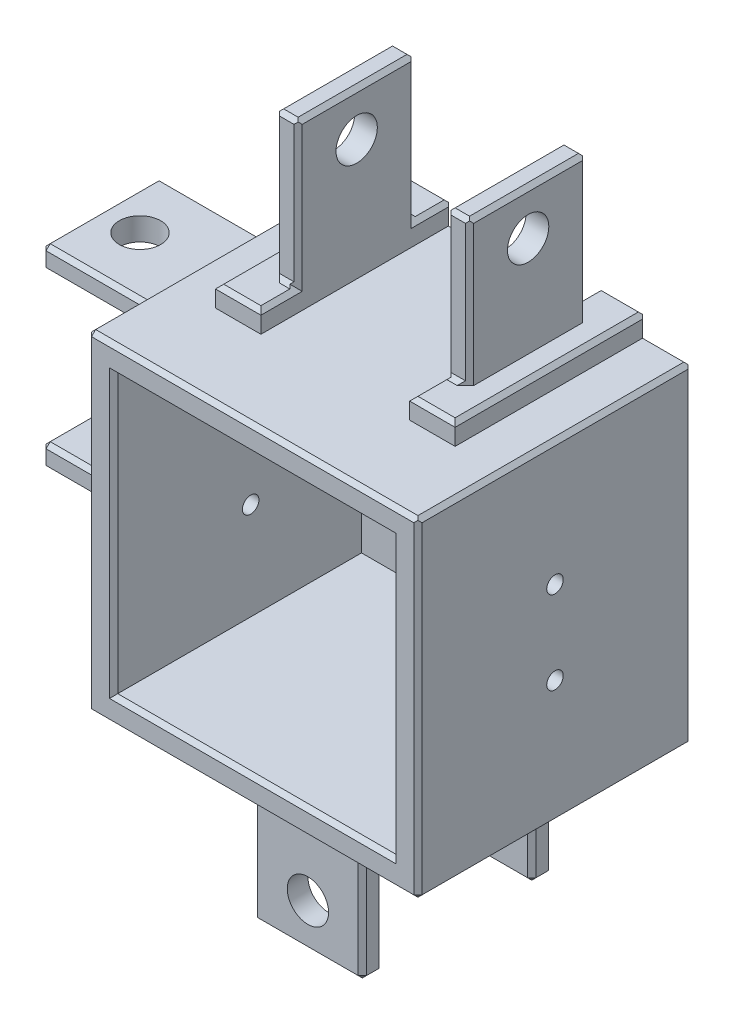
from build123d import *

# Parameters (mm, degrees)
CROQUIS2_W                = 80
CROQUIS2_H                = 80
SALIENTE_EXTRUIR1_DEPTH   = 6.35
CROQUIS4_W                = 80
CROQUIS4_H                = 80
CROQUIS4_W_2              = 67.3
CROQUIS4_H_2              = 67.3
SALIENTE_EXTRUIR2_DEPTH   = 60
CROQUIS5_R                = 30
CORTAR_EXTRUIR1_DEPTH     = 40
SALIENTE_EXTRUIR3_DEPTH   = 5
SALIENTE_EXTRUIR3_2_DEPTH = 5
CROQUIS8_W                = 5.5
CROQUIS8_H                = 28.35
SALIENTE_EXTRUIR4_DEPTH   = 40
CORTAR_EXTRUIR2_REACH     = 112.281
CROQUIS9_R                = 5
SALIENTE_EXTRUIR5_DEPTH   = 5
CROQUIS11_W               = 28.35
CROQUIS11_H               = 5.5
SALIENTE_EXTRUIR6_DEPTH   = 40
CORTAR_EXTRUIR3_REACH     = 117.521
CROQUIS12_R               = 5
CROQUIS13_W               = 46.35
CROQUIS13_H               = 7
SALIENTE_EXTRUIR7_DEPTH   = 5
CROQUIS14_W               = 26.35
CROQUIS14_H               = 5
SALIENTE_EXTRUIR8_DEPTH   = 40
CROQUIS15_R               = 5
CORTAR_EXTRUIR4_DEPTH     = 70
CORTAR_EXTRUIR5_REACH     = 171.094
CROQUIS16_R               = 2
CHAFL_N1_SIZE             = 1
CHAFL_N2_SIZE             = 1
CHAFL_N9_SIZE             = 1
CHAFL_N10_SIZE            = 1
CHAFL_N11_SIZE            = 1
CHAFL_N12_SIZE            = 1
CHAFL_N13_SIZE            = 1
CHAFL_N14_SIZE            = 1
CHAFL_N15_SIZE            = 1


with BuildPart() as part:
    # Croquis2 → Saliente-Extruir1 (new body)
    with BuildSketch(Plane.XY):
        with Locations((9.92481203, -18.947368421)):
            Rectangle(CROQUIS2_W, CROQUIS2_H)
    extrude(amount=SALIENTE_EXTRUIR1_DEPTH)

    # Croquis4 → Saliente-Extruir2 (add)
    with BuildSketch(Plane.XY.offset(6.35)):
        with Locations((9.92481203, -18.947368421)):
            Rectangle(CROQUIS4_W, CROQUIS4_H)
        with Locations((9.92481203, -18.947368421)):
            Rectangle(CROQUIS4_W_2, CROQUIS4_H_2, mode=Mode.SUBTRACT)
    extrude(amount=SALIENTE_EXTRUIR2_DEPTH)

    # Croquis5 → Cortar-Extruir1 (cut)
    with BuildSketch(Plane.XY.offset(6.35)):
        with Locations((9.92481203, -18.947368421)):
            Circle(CROQUIS5_R)
    extrude(amount=-CORTAR_EXTRUIR1_DEPTH, mode=Mode.SUBTRACT)



with BuildPart() as body_2:
    # Croquis6 → Saliente-Extruir3 (new body)
    with BuildSketch(Plane(origin=(0, 21.052631579, 0), x_dir=(1, 0, 0), z_dir=(0, 1, 0))):
        Polygon((38.92481203, 0), (27.92481203, 0), (27.92481203, -9), (33.42481203, -9), (33.42481203, -37.35), (27.92481203, -37.35), (27.92481203, -46.35), (38.92481203, -46.35), align=None)
    extrude(amount=SALIENTE_EXTRUIR3_DEPTH)


with BuildPart() as body_3:
    # Croquis6 → Saliente-Extruir3 2 (new body)
    with BuildSketch(Plane(origin=(0, 21.052631579, 0), x_dir=(1, 0, 0), z_dir=(0, 1, 0))):
        Polygon((-13.57518797, -37.35), (-13.57518797, -9), (-8.07518797, -9), (-8.07518797, 0), (-19.07518797, 0), (-19.07518797, -46.35), (-8.07518797, -46.35), (-8.07518797, -37.35), align=None)
    extrude(amount=SALIENTE_EXTRUIR3_2_DEPTH)


with BuildPart() as part_1:
    add(part.part)

    add(body_2.part)  # Saliente-Extruir4 merges body 2

    add(body_3.part)  # Saliente-Extruir4 merges body 3
    # Croquis8 → Saliente-Extruir4 (add)
    with BuildSketch(Plane(origin=(0, 21.052631579, 0), x_dir=(1, 0, 0), z_dir=(0, 1, 0))):
        with Locations((-10.82518797, -23.175)):
            Rectangle(CROQUIS8_W, CROQUIS8_H)
        with Locations((30.67481203, -23.175)):
            Rectangle(CROQUIS8_W, CROQUIS8_H)
    extrude(amount=SALIENTE_EXTRUIR4_DEPTH)

    # Cortar-Extruir2: up to this face of the body (flat: up to its plane)
    cortar_extruir2_end = Plane(part_1.part.faces().sort_by_distance((33.42481203, 43.552631579, 23.175))[0])
    # Croquis9 → Cortar-Extruir2 (cut, up to the picked face)
    with BuildSketch(Plane.ZY.offset(13.57518797), mode=Mode.PRIVATE) as cortar_extruir2_sk1:
        with Locations((23.175, 50.31614922)):
            Circle(CROQUIS9_R)
    cortar_extruir2_tool1 = split(extrude(cortar_extruir2_sk1.sketch, amount=-CORTAR_EXTRUIR2_REACH, mode=Mode.PRIVATE), bisect_by=cortar_extruir2_end, keep=Keep.BOTH, mode=Mode.PRIVATE)
    add(cortar_extruir2_tool1.solids().sort_by(Axis((-13.575188, 50.316149, 23.175), (1, 0, 0)))[0], mode=Mode.SUBTRACT)

    # Croquis10 → Saliente-Extruir5 (add)
    with BuildSketch(Plane.ZY.offset(30.07518797)):
        Polygon((37.35, 4.552631579), (37.35, -0.947368421), (46.35, -0.947368421), (46.35, 10.052631579), (0, 10.052631579), (0, -0.947368421), (9, -0.947368421), (9, 4.552631579), align=None)
        Polygon((9, -36.947368421), (0, -36.947368421), (0, -47.947368421), (46.35, -47.947368421), (46.35, -36.947368421), (37.35, -36.947368421), (37.35, -42.447368421), (9, -42.447368421), align=None)
    extrude(amount=SALIENTE_EXTRUIR5_DEPTH)

    # Croquis11 → Saliente-Extruir6 (add)
    with BuildSketch(Plane.ZY.offset(30.07518797)):
        with Locations((23.175, 1.802631579)):
            Rectangle(CROQUIS11_W, CROQUIS11_H)
        with Locations((23.175, -39.697368421)):
            Rectangle(CROQUIS11_W, CROQUIS11_H)
    extrude(amount=SALIENTE_EXTRUIR6_DEPTH)

    # Cortar-Extruir3: up to this face of the body (flat: up to its plane)
    cortar_extruir3_end = Plane(part_1.part.faces().sort_by_distance((-52.57518797, -42.447368421, 23.175))[0])
    # Croquis12 → Cortar-Extruir3 (cut, up to the picked face)
    with BuildSketch(Plane(origin=(0, 4.552631579, 0), x_dir=(1, 0, 0), z_dir=(0, 1, 0)), mode=Mode.PRIVATE) as cortar_extruir3_sk1:
        with Locations(Location((-60.518987286, -23.175, 0), (0, 0, 270))):
            Circle(CROQUIS12_R)
    cortar_extruir3_tool1 = split(extrude(cortar_extruir3_sk1.sketch, amount=-CORTAR_EXTRUIR3_REACH, mode=Mode.PRIVATE), bisect_by=cortar_extruir3_end, keep=Keep.BOTH, mode=Mode.PRIVATE)
    add(cortar_extruir3_tool1.solids().sort_by(Axis((-60.518987, 4.552632, 23.175), (0, -1, 0)))[0], mode=Mode.SUBTRACT)

    # Croquis13 → Saliente-Extruir7 (add)
    with BuildSketch(Plane.XZ.offset(58.947368421)):
        with Locations((6.949244079, 5.5)):
            Rectangle(CROQUIS13_W, CROQUIS13_H)
        with Locations((6.949244079, 48.5)):
            Rectangle(CROQUIS13_W, CROQUIS13_H)
    extrude(amount=SALIENTE_EXTRUIR7_DEPTH)

    # Croquis14 → Saliente-Extruir8 (add)
    with BuildSketch(Plane.XZ.offset(58.947368421)):
        with Locations((6.949244079, 47.5)):
            Rectangle(CROQUIS14_W, CROQUIS14_H)
        with Locations((6.949244079, 6.5)):
            Rectangle(CROQUIS14_W, CROQUIS14_H)
    extrude(amount=SALIENTE_EXTRUIR8_DEPTH)

    # Croquis15 → Cortar-Extruir4 (cut)
    with BuildSketch(Plane(origin=(0, 0, 4), x_dir=(-1, 0, 0), z_dir=(0, 0, -1))):
        with Locations((-6.949244079, -88.311094309)):
            Circle(CROQUIS15_R)
    extrude(amount=-CORTAR_EXTRUIR4_DEPTH, mode=Mode.SUBTRACT)

    # Cortar-Extruir5: up to this face of the body (flat: up to its plane)
    cortar_extruir5_end = Plane(part_1.part.faces().sort_by_distance((-30.07518797, -18.947368421, 35.552865355))[0])
    # Croquis16 → Cortar-Extruir5 (cut, up to the picked face)
    with BuildSketch(Plane(origin=(49.92481203, 0, 0), x_dir=(0, 0, -1), z_dir=(1, 0, 0)), mode=Mode.PRIVATE) as cortar_extruir5_sk1:
        with Locations((-33.175, -29.066401089)):
            Circle(CROQUIS16_R)
    cortar_extruir5_tool1 = split(extrude(cortar_extruir5_sk1.sketch, amount=-CORTAR_EXTRUIR5_REACH, mode=Mode.PRIVATE), bisect_by=cortar_extruir5_end, keep=Keep.BOTH, mode=Mode.PRIVATE)
    # Croquis16 → Cortar-Extruir5 (cut, up to the picked face)
    with BuildSketch(Plane(origin=(49.92481203, 0, 0), x_dir=(0, 0, -1), z_dir=(1, 0, 0)), mode=Mode.PRIVATE) as cortar_extruir5_sk2:
        with Locations((-33.175, -8.947368421)):
            Circle(CROQUIS16_R)
    cortar_extruir5_tool2 = split(extrude(cortar_extruir5_sk2.sketch, amount=-CORTAR_EXTRUIR5_REACH, mode=Mode.PRIVATE), bisect_by=cortar_extruir5_end, keep=Keep.BOTH, mode=Mode.PRIVATE)
    add(cortar_extruir5_tool1.solids().sort_by(Axis((49.924812, -29.066401, 33.175), (-1, 0, 0)))[0], mode=Mode.SUBTRACT)
    add(cortar_extruir5_tool2.solids().sort_by(Axis((49.924812, -8.947368, 33.175), (-1, 0, 0)))[0], mode=Mode.SUBTRACT)

    # Chaflán1
    chafl_n1_edges = [part_1.edges().sort_by_distance(p)[0] for p in [
        (-30.07518797, -18.947368421, 0),
        (-32.57518797, 10.052631579, 0),
        (-32.57518797, -0.947368421, 0),
        (-35.07518797, 4.552631579, 0),
        (-30.07518797, -53.447368421, 0),
        (-32.57518797, -36.947368421, 0),
        (-32.57518797, -47.947368421, 0),
        (-35.07518797, -42.447368421, 0),
        (-30.07518797, -18.947368421, 66.35),
        (9.92481203, -58.947368421, 66.35),
        (49.92481203, -18.947368421, 66.35),
        (9.92481203, 21.052631579, 66.35),
        (49.92481203, -18.947368421, 0),
        (9.92481203, -58.947368421, 0),
        (-30.07518797, 15.552631579, 0),
        (-24.57518797, 21.052631579, 0),
        (44.42481203, 21.052631579, 0),
        (-8.07518797, 23.552631579, 0),
        (-19.07518797, 23.552631579, 0),
        (-13.57518797, 26.052631579, 0),
        (49.92481203, -58.947368421, 33.175),
        (9.92481203, 21.052631579, 0),
        (-30.07518797, -58.947368421, 33.175),
        (-30.07518797, 21.052631579, 33.175),
        (38.92481203, 23.552631579, 0),
        (27.92481203, 23.552631579, 0),
        (33.42481203, 26.052631579, 0),
    ]]
    chamfer(chafl_n1_edges, length=CHAFL_N1_SIZE)

    # Chaflán2
    chafl_n2_edges = [part_1.edges().sort_by_distance(p)[0] for p in [
        (-23.72518797, -18.947368421, 66.35),
        (9.92481203, -52.597368421, 66.35),
        (43.57481203, -18.947368421, 66.35),
        (9.92481203, 14.702631579, 66.35),
        (49.92481203, 21.052631579, 33.175),
    ]]
    chamfer(chafl_n2_edges, length=CHAFL_N2_SIZE)

    # Chaflán9
    chafl_n9_edges = [part_1.edges().sort_by_distance(p)[0] for p in [
        (-8.07518797, 61.052631579, 23.175),
        (-10.82518797, 61.052631579, 9),
        (-13.57518797, 61.052631579, 23.175),
        (-10.82518797, 61.052631579, 37.35),
    ]]
    chamfer(chafl_n9_edges, length=CHAFL_N9_SIZE)

    # Chaflán10
    chafl_n10_edges = [part_1.edges().sort_by_distance(p)[0] for p in [
        (30.67481203, 61.052631579, 9),
        (27.92481203, 61.052631579, 23.175),
        (30.67481203, 61.052631579, 37.35),
        (33.42481203, 61.052631579, 23.175),
    ]]
    chamfer(chafl_n10_edges, length=CHAFL_N10_SIZE)

    # Chaflán11
    chafl_n11_edges = [part_1.edges().sort_by_distance(p)[0] for p in [
        (38.92481203, 26.052631579, 23.675),
        (27.92481203, 26.052631579, 5),
        (-8.07518797, 26.052631579, 5),
        (-19.07518797, 26.052631579, 23.675),
        (-13.57518797, 43.052631579, 37.35),
        (-13.57518797, 43.052631579, 9),
        (-8.07518797, 43.052631579, 9),
        (-8.07518797, 43.052631579, 37.35),
        (33.42481203, 43.052631579, 9),
        (33.42481203, 43.052631579, 37.35),
        (27.92481203, 43.052631579, 37.35),
        (27.92481203, 43.052631579, 9),
        (-13.57518797, 26.052631579, 46.35),
        (-8.07518797, 26.052631579, 41.85),
        (27.92481203, 26.052631579, 41.85),
        (33.42481203, 26.052631579, 46.35),
    ]]
    chamfer(chafl_n11_edges, length=CHAFL_N11_SIZE)

    # Chaflán12
    chafl_n12_edges = [part_1.edges().sort_by_distance(p)[0] for p in [
        (-35.07518797, -0.947368421, 41.85),
        (-35.07518797, 4.552631579, 46.35),
        (-35.07518797, -36.947368421, 41.85),
        (-35.07518797, -42.447368421, 46.35),
        (-52.57518797, 4.552631579, 37.35),
        (-52.57518797, 4.552631579, 9),
        (-52.57518797, -0.947368421, 9),
        (-52.57518797, -0.947368421, 37.35),
        (-70.07518797, 4.552631579, 23.175),
        (-70.07518797, 1.802631579, 9),
        (-70.07518797, -0.947368421, 23.175),
        (-70.07518797, 1.802631579, 37.35),
        (-52.57518797, -36.947368421, 37.35),
        (-52.57518797, -36.947368421, 9),
        (-52.57518797, -42.447368421, 9),
        (-52.57518797, -42.447368421, 37.35),
        (-70.07518797, -36.947368421, 23.175),
        (-70.07518797, -39.697368421, 9),
        (-70.07518797, -42.447368421, 23.175),
        (-70.07518797, -39.697368421, 37.35),
        (-35.07518797, 10.052631579, 23.675),
        (-35.07518797, -0.947368421, 5),
        (-35.07518797, -36.947368421, 5),
        (-35.07518797, -47.947368421, 23.675),
    ]]
    chamfer(chafl_n12_edges, length=CHAFL_N12_SIZE)

    # Chaflán13
    chafl_n13_edges = [part_1.edges().sort_by_distance(p)[0] for p in [
        (6.949244079, -63.947368421, 52),
        (-16.225755921, -63.947368421, 48.5),
        (-11.225755921, -63.947368421, 45),
        (30.124244079, -63.947368421, 48.5),
        (-11.225755921, -63.947368421, 9),
        (6.949244079, -63.947368421, 2),
        (30.124244079, -63.947368421, 5.5),
        (-16.225755921, -63.947368421, 5.5),
        (25.124244079, -63.947368421, 9),
        (20.124244079, -63.947368421, 6.5),
        (6.949244079, -63.947368421, 4),
        (-6.225755921, -63.947368421, 6.5),
        (-6.225755921, -81.447368421, 9),
        (-6.225755921, -81.447368421, 4),
        (20.124244079, -81.447368421, 4),
        (20.124244079, -81.447368421, 9),
        (-6.225755921, -98.947368421, 6.5),
        (6.949244079, -98.947368421, 4),
        (20.124244079, -98.947368421, 6.5),
        (6.949244079, -98.947368421, 9),
        (25.124244079, -63.947368421, 45),
        (6.949244079, -63.947368421, 50),
        (20.124244079, -63.947368421, 47.5),
        (-6.225755921, -63.947368421, 47.5),
        (-6.225755921, -81.447368421, 50),
        (-6.225755921, -81.447368421, 45),
        (20.124244079, -81.447368421, 45),
        (20.124244079, -81.447368421, 50),
        (-6.225755921, -98.947368421, 47.5),
        (6.949244079, -98.947368421, 45),
        (20.124244079, -98.947368421, 47.5),
        (6.949244079, -98.947368421, 50),
    ]]
    chamfer(chafl_n13_edges, length=CHAFL_N13_SIZE - 0.0001)  # a hair under: the kernel refuses the full size

    # Chaflán14
    chafl_n14_edges = [part_1.edges().sort_by_distance(p)[0] for p in [
        (30.67481203, 26.052631579, 37.35),
        (-10.82518797, 26.052631579, 37.35),
        (30.67481203, 26.052631579, 9),
        (-10.82518797, 26.052631579, 9),
        (-35.07518797, -39.697368421, 9),
        (-35.07518797, -39.697368421, 37.35),
        (-35.07518797, 1.802631579, 9),
        (-35.07518797, 1.802631579, 37.35),
    ]]
    chamfer(chafl_n14_edges, length=CHAFL_N14_SIZE)

    # Chaflán15
    chafl_n15_edges = [part_1.edges().sort_by_distance(p)[0] for p in [
        (-20.07518797, -18.947368421, 0),
        (-20.07518797, -18.947368421, 6.35),
    ]]
    chamfer(chafl_n15_edges, length=CHAFL_N15_SIZE)


solid = part_1.part
